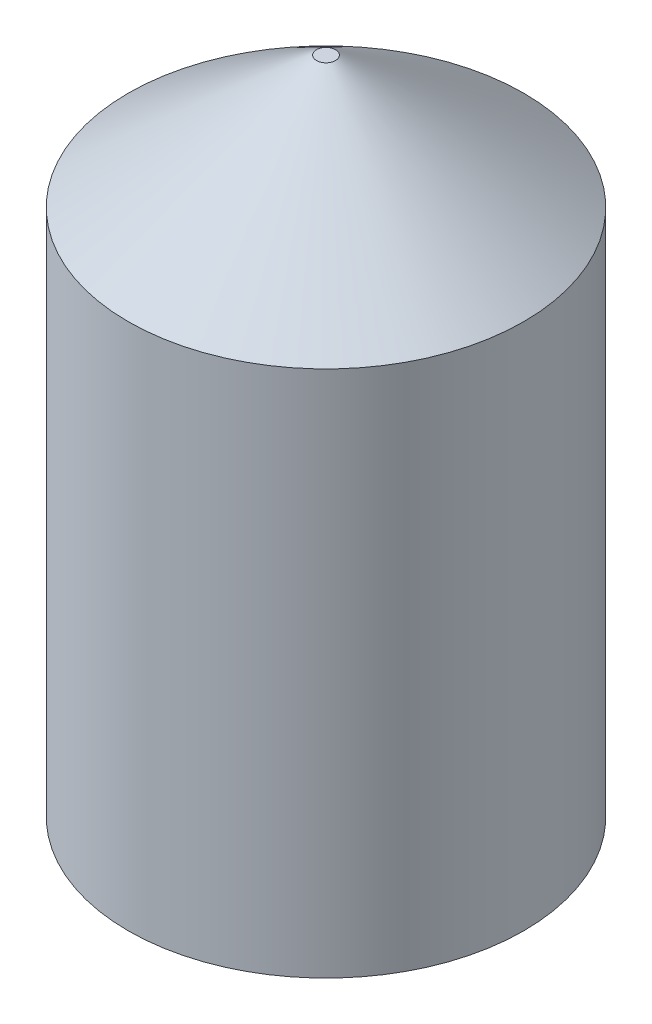
from build123d import *

# Parameters (mm, degrees)
SKETCH1_R           = 30
BOSS_EXTRUDE1_DEPTH = 100
SKETCH2_R           = 2
CUT_EXTRUDE1_DEPTH  = 20
CHAMFER1_SIZE       = 20
CHAMFER1_SIZE2      = 28.562960135


with BuildPart() as part:
    # Sketch1 → Boss-Extrude1 (new body)
    with BuildSketch(Plane(origin=(0, 0, 0), x_dir=(1, 0, 0), z_dir=(0, 1, 0))):
        Circle(SKETCH1_R)
    extrude(amount=BOSS_EXTRUDE1_DEPTH)

    # Sketch2 → Cut-Extrude1 (cut)
    with BuildSketch(Plane.XZ):
        Circle(SKETCH2_R)
    extrude(amount=-CUT_EXTRUDE1_DEPTH, mode=Mode.SUBTRACT)

    # Chamfer1
    chamfer1_edges = [part.edges().sort_by_distance(p)[0] for p in [
        (-30, 100, 0),
    ]]
    chamfer1_side = [part.faces().sort_by_distance(p)[0] for p in [
        (-30, 50, 0),
    ]]
    chamfer(chamfer1_edges, length=CHAMFER1_SIZE, length2=CHAMFER1_SIZE2, reference=chamfer1_side[0])


solid = part.part
